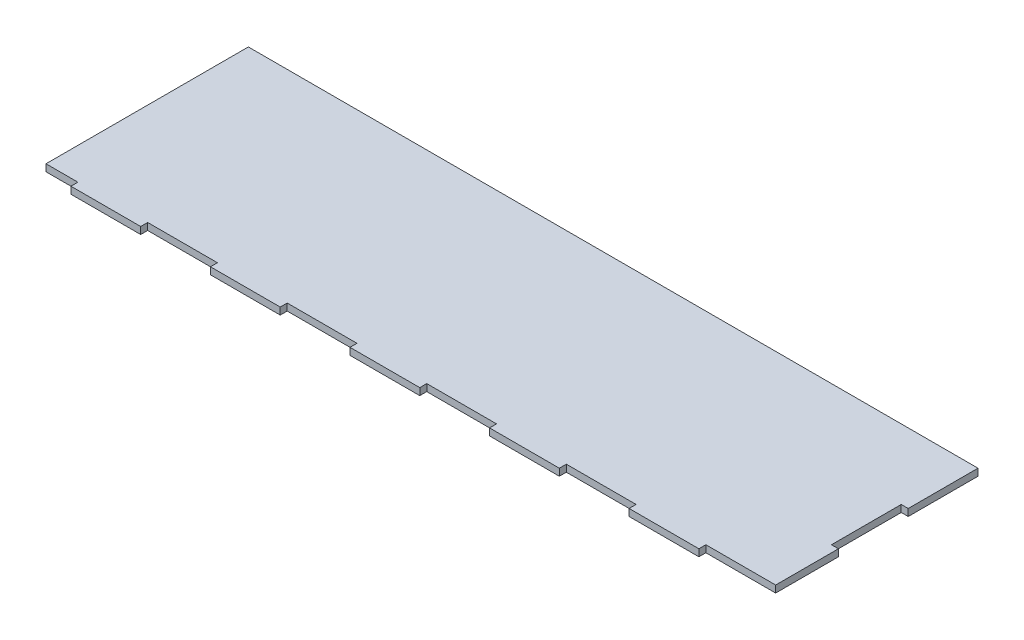
from build123d import *

# Parameters (mm, degrees)
SKETCH1_W              = 630
SKETCH1_H              = 90
BOSS_EXTRUDE1_DEPTH    = 3
SKETCH3_W              = 30
SKETCH3_H              = 3
CUT_EXTRUDE1_DEPTH     = 3
LPATTERN1_COUNT        = 10
LPATTERN1_PITCH        = 60
LPATTERN1_COL_COUNT    = 2
LPATTERN1_COL_PITCH    = 60
CUT_EXTRUDE5_START     = -3
CUT_EXTRUDE5_OUTLINE_W = 3
CUT_EXTRUDE5_OUTLINE_H = 30
CUT_EXTRUDE5_DEPTH     = 3
SKETCH7_W              = 3
SKETCH7_H              = 30
CUT_EXTRUDE3_DEPTH     = 3
SKETCH13_W             = 3
SKETCH13_H             = 27
CUT_EXTRUDE4_DEPTH     = 10


# Read off the part's stored shape, not the designer's step: Cut-Extrude5
with BuildPart() as part:
    # Sketch1 → Boss-Extrude1 (new body)
    with BuildSketch(Plane(origin=(0, 0, 0), x_dir=(1, 0, 0), z_dir=(0, 1, 0))):
        Rectangle(SKETCH1_W, SKETCH1_H)
    extrude(amount=BOSS_EXTRUDE1_DEPTH)

    # Sketch3 → Cut-Extrude1 (cut)
    with BuildSketch(Plane(origin=(0, 3, 0), x_dir=(1, 0, 0), z_dir=(0, 1, 0))):
        with Locations((-240, -43.5)):
            Rectangle(SKETCH3_W, SKETCH3_H)
    cut_extrude1 = extrude(amount=-CUT_EXTRUDE1_DEPTH, mode=Mode.SUBTRACT)

    # LPattern1: Cut-Extrude1 ×10
    with Locations(*[(i * LPATTERN1_PITCH, 0, 0) for i in range(1, LPATTERN1_COUNT)]):
        add(cut_extrude1, mode=Mode.SUBTRACT)

    # LPattern1 col: Cut-Extrude1 ×2
    with Locations(*[(-i * LPATTERN1_COL_PITCH, 0, 0) for i in range(1, LPATTERN1_COL_COUNT)]):
        add(cut_extrude1, mode=Mode.SUBTRACT)

    # Cut-Extrude5 outline → Cut-Extrude5 (cut)
    with BuildSketch(Plane(origin=(0, 3, 0), x_dir=(1, 0, 0), z_dir=(0, 1, 0)).offset(CUT_EXTRUDE5_START)):
        with Locations((313.5, 1e-09)):
            Rectangle(CUT_EXTRUDE5_OUTLINE_W, CUT_EXTRUDE5_OUTLINE_H)
    extrude(amount=CUT_EXTRUDE5_DEPTH, mode=Mode.SUBTRACT)

    # Sketch7 → Cut-Extrude3 (cut)
    with BuildSketch(Plane(origin=(0, 3, 0), x_dir=(1, 0, 0), z_dir=(0, 1, 0))):
        with Locations((-313.5, 30)):
            Rectangle(SKETCH7_W, SKETCH7_H)
    extrude(amount=-CUT_EXTRUDE3_DEPTH, mode=Mode.SUBTRACT)

    # Sketch13 → Cut-Extrude4 (cut)
    with BuildSketch(Plane(origin=(0, 3, 0), x_dir=(1, 0, 0), z_dir=(0, 1, 0))):
        with Locations((-313.5, -28.5)):
            Rectangle(SKETCH13_W, SKETCH13_H)
    extrude(amount=-CUT_EXTRUDE4_DEPTH, mode=Mode.SUBTRACT)

    # SurfaceCut1
    split(bisect_by=Plane.ZY.offset(-1.295), keep=Keep.BOTTOM)


solid = part.part
